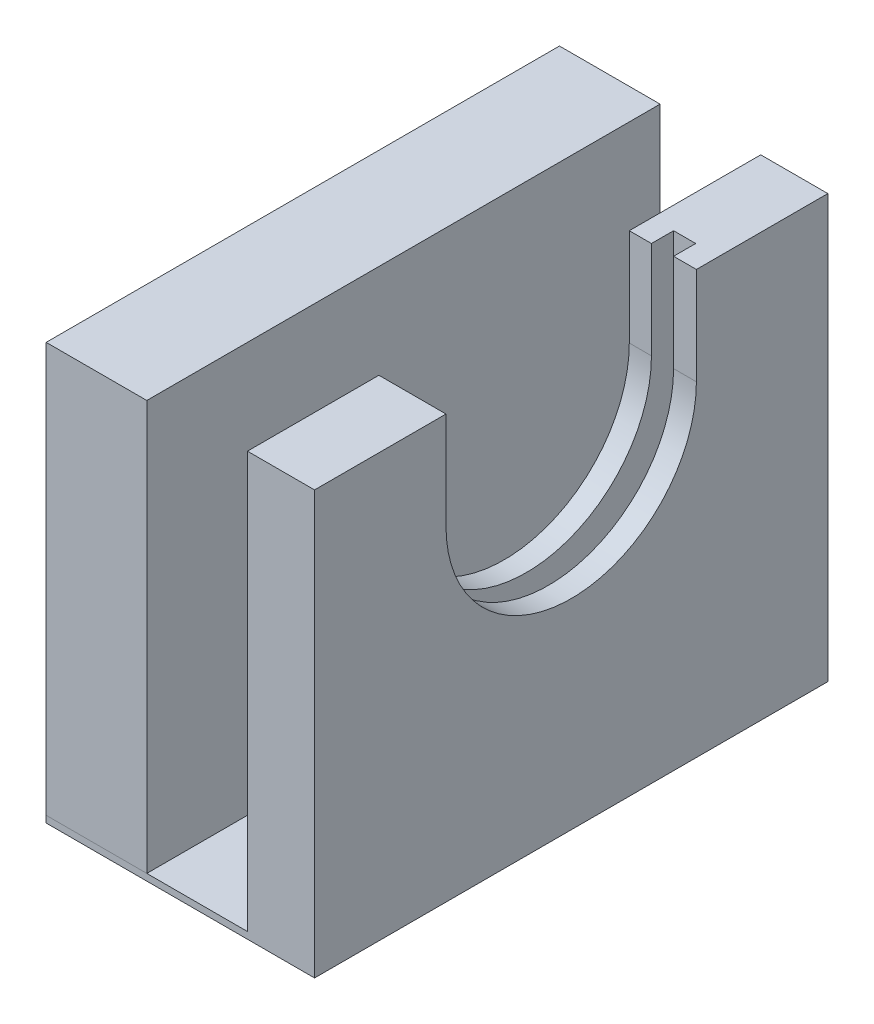
from build123d import *

# Parameters (mm, degrees)
SKETCH1_W           = 10
SKETCH1_H           = 62
BOSS_EXTRUDE1_DEPTH = 76.5
CUT_EXTRUDE1_DEPTH  = 76.5
CUT_EXTRUDE3_START  = 3.3
CUT_EXTRUDE3_DEPTH  = 3.3
SKETCH4_W           = 40
SKETCH4_H           = 76.5
BOSS_EXTRUDE2_DEPTH = 1
SKETCH5_W           = 15
SKETCH5_H           = 61.045159153
BOSS_EXTRUDE3_DEPTH = 76.5


# Read off the part's stored shape, not the designer's step: Cut-Extrude3
with BuildPart() as part:
    # Sketch1 → Boss-Extrude1 (new body)
    with BuildSketch(Plane.XY):
        with Locations((5, 31)):
            Rectangle(SKETCH1_W, SKETCH1_H)
    extrude(amount=BOSS_EXTRUDE1_DEPTH)

    # Sketch2 → Cut-Extrude1 (cut)
    with BuildSketch(Plane(origin=(10, 0, 0), x_dir=(0, 0, -1), z_dir=(1, 0, 0))):
        with BuildLine():
            Line((-19.59, 62), (-56.91, 62))
            Line((-56.91, 62), (-56.91, 47.5))
            ThreePointArc((-56.91, 47.5), (-38.25, 28.84), (-19.59, 47.5))
            Line((-19.59, 47.5), (-19.59, 62))
        make_face()
    extrude(amount=-CUT_EXTRUDE1_DEPTH, mode=Mode.SUBTRACT)

    # Cut-Extrude3 outline → Cut-Extrude3 (cut)
    with BuildSketch(Plane.YZ.offset(CUT_EXTRUDE3_START)):
        with BuildLine():
            ThreePointArc((47.5, 19.59), (28.84, 38.25), (47.5, 56.91))
            Line((47.5, 56.91), (32.953522763, 56.91))
            ThreePointArc((32.953522763, 56.91), (24.072746784, 34.939500531), (38.693525109, 16.29))
            Line((38.693525109, 16.29), (62, 16.29))
            Line((62, 16.29), (62, 19.59))
            Line((62, 19.59), (47.5, 19.59))
        make_face()
    extrude(amount=CUT_EXTRUDE3_DEPTH, mode=Mode.SUBTRACT)

    # Sketch4 → Boss-Extrude2 (add)
    with BuildSketch(Plane.XZ):
        with Locations((-10, 38.25)):
            Rectangle(SKETCH4_W, SKETCH4_H)
    extrude(amount=BOSS_EXTRUDE2_DEPTH)


with BuildPart() as body_2:
    # Sketch5 → Boss-Extrude3 (new body)
    with BuildSketch(Plane.XY.offset(76.5)):
        with Locations((-22.5, 30.522579577)):
            Rectangle(SKETCH5_W, SKETCH5_H)
    extrude(amount=-BOSS_EXTRUDE3_DEPTH)


solid = Compound([part.part, body_2.part])
